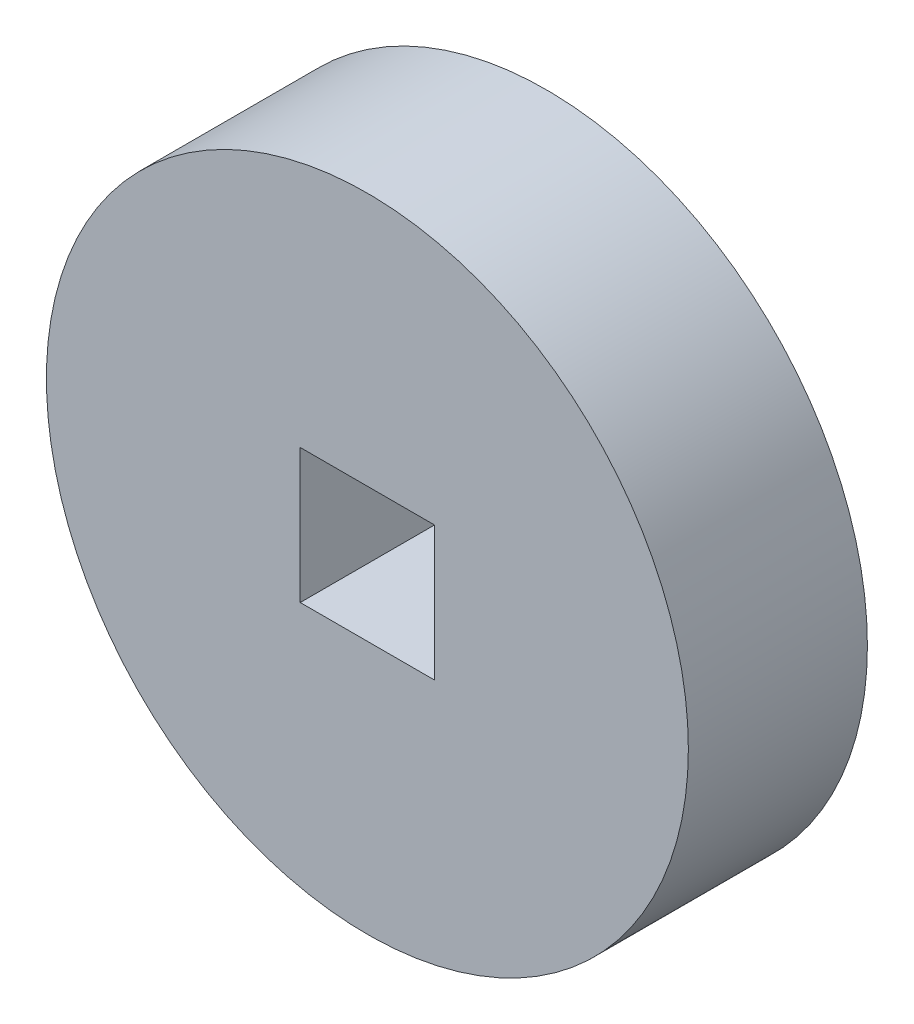
from build123d import *

# Parameters (mm, degrees)
SKETCH_1_R      = 7.170680043
SKETCH_1_W      = 3
SKETCH_1_H      = 3
EXTRUDE_1_DEPTH = 4


with BuildPart() as part:
    # 草图1 → 凸台-拉伸1 (new body)
    with BuildSketch(Plane.XY):
        Circle(SKETCH_1_R)
        Rectangle(SKETCH_1_W, SKETCH_1_H, mode=Mode.SUBTRACT)
    extrude(amount=EXTRUDE_1_DEPTH)


solid = part.part
